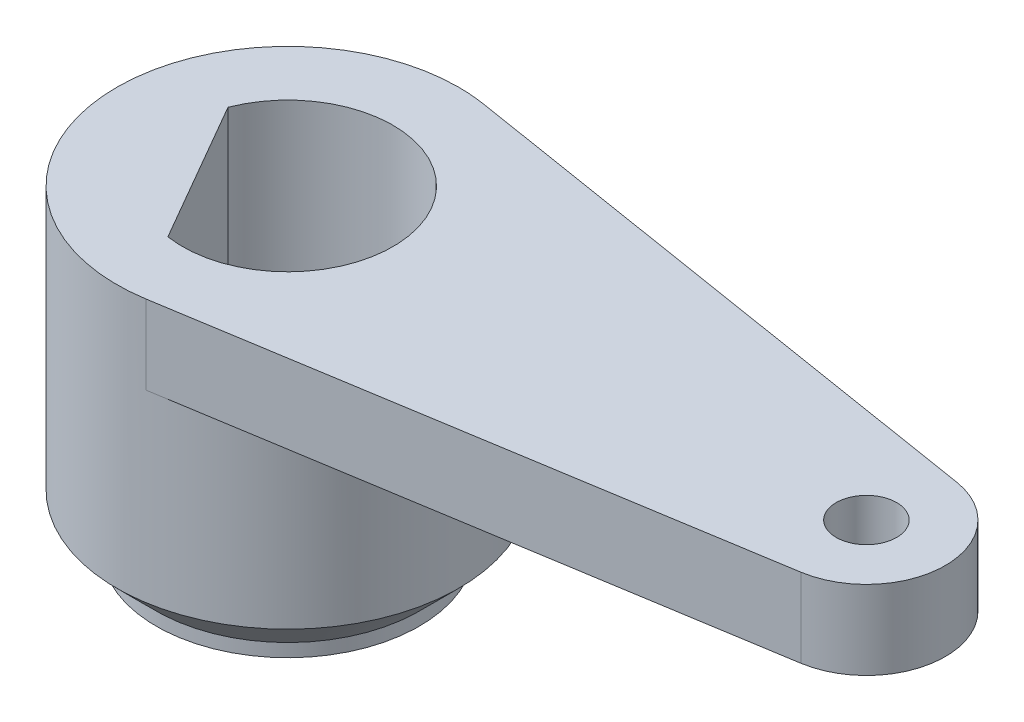
from build123d import *

# Parameters (mm, degrees)
SKETCH1_R           = 6.5
SKETCH1_R_2         = 4
BOSS_EXTRUDE1_DEPTH = 12
BOSS_EXTRUDE2_START = -3
SKETCH2_R           = 1.15
BOSS_EXTRUDE2_DEPTH = 3
SKETCH4_R           = 6.5
SKETCH4_R_2         = 5
CUT_EXTRUDE1_DEPTH  = 2
BOSS_EXTRUDE4_START = -10
BOSS_EXTRUDE4_DEPTH = 10
CHAMFER1_SIZE       = 1.5


with BuildPart() as part:
    # Sketch1 → Boss-Extrude1 (new body)
    with BuildSketch(Plane(origin=(0, 0, 0), x_dir=(1, 0, 0), z_dir=(0, 1, 0))):
        with Locations(Location((0, 0, 0), (0, 0, 270))):
            Circle(SKETCH1_R)
        with Locations(Location((0, 0, 0), (0, 0, 270))):
            Circle(SKETCH1_R_2, mode=Mode.SUBTRACT)
    extrude(amount=BOSS_EXTRUDE1_DEPTH)

    # Sketch2 → Boss-Extrude2 (add)
    with BuildSketch(Plane(origin=(0, 12, 0), x_dir=(1, 0, 0), z_dir=(0, 1, 0)).offset(BOSS_EXTRUDE2_START)):
        with BuildLine():
            Line((22.477272727, 2.961791813), (1.034090909, 6.417215595))
            ThreePointArc((1.034090909, 6.417215595), (4.948312384, 4.214760319), (6.5, 0))
            ThreePointArc((6.5, 0), (4.948312384, -4.214760319), (1.034090909, -6.417215595))
            Line((1.034090909, -6.417215595), (22.477272727, -2.961791813))
            ThreePointArc((22.477272727, -2.961791813), (25, 0), (22.477272727, 2.961791813))
        make_face()
        with Locations(Location((22, 0, 0), (0, 0, 270))):
            Circle(SKETCH2_R, mode=Mode.SUBTRACT)
    extrude(amount=BOSS_EXTRUDE2_DEPTH)

    # Sketch4 → Cut-Extrude1 (cut)
    with BuildSketch(Plane.XZ):
        with Locations(Location((0, 0, 0), (0, 0, 270))):
            Circle(SKETCH4_R)
        with Locations(Location((0, 0, 0), (0, 0, 270))):
            Circle(SKETCH4_R_2, mode=Mode.SUBTRACT)
    extrude(amount=-CUT_EXTRUDE1_DEPTH, mode=Mode.SUBTRACT)

    # Sketch5 → Boss-Extrude4 (add)
    with BuildSketch(Plane(origin=(0, 12, 0), x_dir=(1, 0, 0), z_dir=(0, 1, 0)).offset(BOSS_EXTRUDE4_START)):
        with BuildLine():
            Line((-0.60381401, -3.954163457), (-3.726313009, 1.454163457))
            ThreePointArc((-3.726313009, 1.454163457), (-3.464101615, -2), (-0.60381401, -3.954163457))
        make_face()
    extrude(amount=BOSS_EXTRUDE4_DEPTH)

    # Chamfer1
    chamfer1_edges = [part.edges().sort_by_distance(p)[0] for p in [
        (0, 2, 5),
    ]]
    chamfer(chamfer1_edges, length=CHAMFER1_SIZE - 0.0001)  # a hair under: the kernel refuses the full size


solid = part.part
